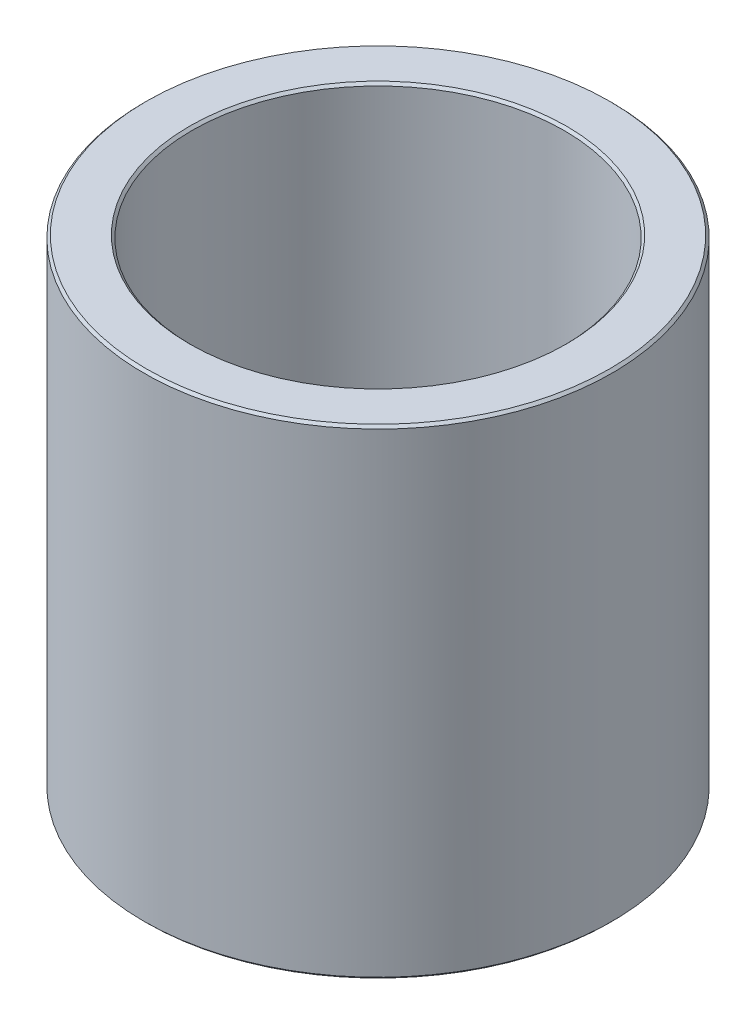
from build123d import *

# Parameters (mm, degrees)
SKETCH1_R           = 52.5
BOSS_EXTRUDE1_DEPTH = 107.535181572
SKETCH2_R           = 41.722124336
CUT_EXTRUDE1_DEPTH  = 131.67637612
CHAMFER1_SIZE       = 0.553045641


with BuildPart() as part:
    # Sketch1 → Boss-Extrude1 (new body)
    with BuildSketch(Plane(origin=(0, 0, 0), x_dir=(1, 0, 0), z_dir=(0, 1, 0))):
        Circle(SKETCH1_R)
    extrude(amount=BOSS_EXTRUDE1_DEPTH)

    # Sketch2 → Cut-Extrude1 (cut, through all)
    with BuildSketch(Plane(origin=(0, 0, 0), x_dir=(1, 0, 0), z_dir=(0, 1, 0))):
        Circle(SKETCH2_R)
    extrude(amount=CUT_EXTRUDE1_DEPTH, mode=Mode.SUBTRACT)

    # Chamfer1
    chamfer1_edges = [part.edges().sort_by_distance(p)[0] for p in [
        (-41.722124336, 107.535181572, 0),
        (-41.722124336, 0, 0),
        (-52.5, 0, 0),
        (-52.5, 107.535181572, 0),
    ]]
    chamfer(chamfer1_edges, length=CHAMFER1_SIZE)


solid = part.part
